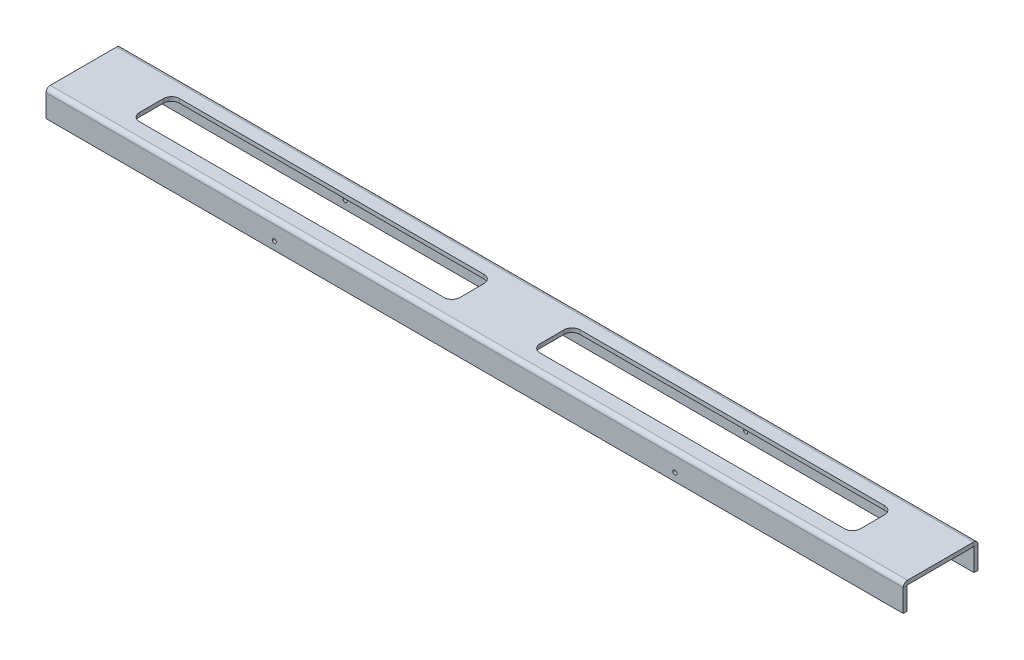
from build123d import *

# Parameters (mm, degrees)
SKETCH_1_W                         = 321
SKETCH_1_H                         = 60
SM_BASE_FLANGE_1_DEPTH             = 1.5
SM_EDGE_FLANGE_1_STRIP_W           = 6.2
SM_EDGE_FLANGE_1_STRIP_H           = 1.5
SM_EDGE_FLANGE_1_STRIP_CUT_DEPTH   = 321
SM_EDGE_FLANGE_1_STRIP_2_W         = 6.2
SM_EDGE_FLANGE_1_STRIP_2_H         = 1.5
SM_EDGE_FLANGE_1_STRIP_CUT_2_DEPTH = 321
SM_EDGE_FLANGE_1_DEPTH             = 321
SM_EDGE_FLANGE_1_BEND_DEPTH        = 321
SM_EDGE_FLANGE_2_STRIP_W           = 6.2
SM_EDGE_FLANGE_2_STRIP_H           = 1.5
SM_EDGE_FLANGE_2_STRIP_CUT_DEPTH   = 321
SM_EDGE_FLANGE_2_STRIP_2_W         = 6.2
SM_EDGE_FLANGE_2_STRIP_2_H         = 1.5
SM_EDGE_FLANGE_2_STRIP_CUT_2_DEPTH = 321
SM_EDGE_FLANGE_2_DEPTH             = 321
SM_EDGE_FLANGE_2_BEND_DEPTH        = 321
CUT_EXTRUDE_2_DEPTH                = 174.385408844
CUT_EXTRUDE_3_DEPTH                = 57
CUT_EXTRUDE_3_DEPTH_BACK           = 10
SKETCH_20_W                        = 341.087454661
SKETCH_20_H                        = 74.910603127
CUT_EXTRUDE_4_DEPTH                = 166.663061664
CUT_EXTRUDE_4_DEPTH_BACK           = 166.663061664
SKETCH_21_R                        = 0.75


# Sheet-metal steps are written as plain solids
with BuildPart() as part:
    # Sketch 1 → 基体-法兰1 (new body)
    with BuildSketch(Plane.XY):
        Rectangle(SKETCH_1_W, SKETCH_1_H)
    extrude(amount=-SM_BASE_FLANGE_1_DEPTH)

    # 边线-法兰1 strip (across the edge) → 边线-法兰1 strip cut (cut)
    with BuildSketch(Plane(origin=(160.5, 30, 0), x_dir=(0, -1, 0), z_dir=(-1, 0, 0))):
        with Locations((-1.5, -0.75)):
            Rectangle(SM_EDGE_FLANGE_1_STRIP_W, SM_EDGE_FLANGE_1_STRIP_H)
    extrude(amount=SM_EDGE_FLANGE_1_STRIP_CUT_DEPTH, mode=Mode.SUBTRACT)

    # 边线-法兰1 strip 2 (across the edge) → 边线-法兰1 strip cut 2 (cut)
    with BuildSketch(Plane(origin=(-160.5, -30, 0), x_dir=(0, 1, 0), z_dir=(1, 0, 0))):
        with Locations((-1.5, -0.75)):
            Rectangle(SM_EDGE_FLANGE_1_STRIP_2_W, SM_EDGE_FLANGE_1_STRIP_2_H)
    extrude(amount=SM_EDGE_FLANGE_1_STRIP_CUT_2_DEPTH, mode=Mode.SUBTRACT)

    # 边线-法兰1 section (across the edge) → 边线-法兰1 (add)
    with BuildSketch(Plane(origin=(160.5, 30, 0), x_dir=(0, -1, 0), z_dir=(-1, 0, 0))):
        with BuildLine():
            Line((0, 0.1), (0, 26.5))
            Line((0, 26.5), (1.5, 26.5))
            Line((1.5, 26.5), (1.5, 0.1))
            ThreePointArc((1.5, 0.1), (1.529289322, 0.029289322), (1.6, 0))
            Line((1.6, 0), (1.6, -1.5))
            ThreePointArc((1.6, -1.5), (0.46862915, -1.03137085), (0, 0.1))
        make_face()
    extrude(amount=SM_EDGE_FLANGE_1_DEPTH)

    # 边线-法兰1 section 2 (across the edge) → 边线-法兰1 bend (add)
    with BuildSketch(Plane(origin=(-160.5, -30, 0), x_dir=(0, 1, 0), z_dir=(1, 0, 0))):
        with BuildLine():
            Line((0, 0.1), (0, 26.5))
            Line((0, 26.5), (1.5, 26.5))
            Line((1.5, 26.5), (1.5, 0.1))
            ThreePointArc((1.5, 0.1), (1.529289322, 0.029289322), (1.6, 0))
            Line((1.6, 0), (1.6, -1.5))
            ThreePointArc((1.6, -1.5), (0.46862915, -1.03137085), (0, 0.1))
        make_face()
    extrude(amount=SM_EDGE_FLANGE_1_BEND_DEPTH)

    # 边线-法兰2 strip (across the edge) → 边线-法兰2 strip cut (cut)
    with BuildSketch(Plane(origin=(160.5, 28.5, 26.5), x_dir=(0, 0, -1), z_dir=(-1, 0, 0))):
        with Locations((-1.5, -0.75)):
            Rectangle(SM_EDGE_FLANGE_2_STRIP_W, SM_EDGE_FLANGE_2_STRIP_H)
    extrude(amount=SM_EDGE_FLANGE_2_STRIP_CUT_DEPTH, mode=Mode.SUBTRACT)

    # 边线-法兰2 strip 2 (across the edge) → 边线-法兰2 strip cut 2 (cut)
    with BuildSketch(Plane(origin=(-160.5, -28.5, 26.5), x_dir=(0, 0, -1), z_dir=(1, 0, 0))):
        with Locations((-1.5, -0.75)):
            Rectangle(SM_EDGE_FLANGE_2_STRIP_2_W, SM_EDGE_FLANGE_2_STRIP_2_H)
    extrude(amount=SM_EDGE_FLANGE_2_STRIP_CUT_2_DEPTH, mode=Mode.SUBTRACT)

    # 边线-法兰2 section (across the edge) → 边线-法兰2 (add)
    with BuildSketch(Plane(origin=(160.5, 28.5, 26.5), x_dir=(0, 0, -1), z_dir=(-1, 0, 0))):
        with BuildLine():
            Line((0, 0.1), (0, 8.5))
            Line((0, 8.5), (1.5, 8.5))
            Line((1.5, 8.5), (1.5, 0.1))
            ThreePointArc((1.5, 0.1), (1.529289322, 0.029289322), (1.6, 0))
            Line((1.6, 0), (1.6, -1.5))
            ThreePointArc((1.6, -1.5), (0.46862915, -1.03137085), (0, 0.1))
        make_face()
    extrude(amount=SM_EDGE_FLANGE_2_DEPTH)

    # 边线-法兰2 section 2 (across the edge) → 边线-法兰2 bend (add)
    with BuildSketch(Plane(origin=(-160.5, -28.5, 26.5), x_dir=(0, 0, -1), z_dir=(1, 0, 0))):
        with BuildLine():
            Line((0, 0.1), (0, 8.5))
            Line((0, 8.5), (1.5, 8.5))
            Line((1.5, 8.5), (1.5, 0.1))
            ThreePointArc((1.5, 0.1), (1.529289322, 0.029289322), (1.6, 0))
            Line((1.6, 0), (1.6, -1.5))
            ThreePointArc((1.6, -1.5), (0.46862915, -1.03137085), (0, 0.1))
        make_face()
    extrude(amount=SM_EDGE_FLANGE_2_BEND_DEPTH)

    # 草图19 → 切除-拉伸2 (cut, through all)
    with BuildSketch(Plane(origin=(0, 30, 0), x_dir=(1, 0, 0), z_dir=(0, 1, 0))):
        with BuildLine():
            Line((-132, -5), (-18, -5))
            ThreePointArc((-18, -5), (-15.878679656, -5.878679656), (-15, -8))
            Line((-15, -8), (-15, -17))
            ThreePointArc((-15, -17), (-15.878679656, -19.121320344), (-18, -20))
            Line((-18, -20), (-132, -20))
            ThreePointArc((-132, -20), (-134.121320344, -19.121320344), (-135, -17))
            Line((-135, -17), (-135, -8))
            ThreePointArc((-135, -8), (-134.121320344, -5.878679656), (-132, -5))
        make_face()
    cut_extrude_2 = extrude(amount=-CUT_EXTRUDE_2_DEPTH, mode=Mode.SUBTRACT)

    # 镜向1: 切除-拉伸2 across plane
    add(cut_extrude_2.mirror(Plane(origin=(0, 0, 0), x_dir=(0, 0, 1), z_dir=(1, 0, 0))), mode=Mode.SUBTRACT)

    # 草图20 → 切除-拉伸3 (cut, two sides: drawn at the far end of the back side and taken through both)
    with BuildSketch(Plane.XY.offset(-CUT_EXTRUDE_3_DEPTH_BACK)):
        with Locations((-10.043727331, -17.455301564)):
            Rectangle(SKETCH_20_W, SKETCH_20_H)
    extrude(amount=CUT_EXTRUDE_3_DEPTH + CUT_EXTRUDE_3_DEPTH_BACK, mode=Mode.SUBTRACT)

    # 草图21 → 切除-拉伸4 (cut, two sides: drawn at the far end of the back side and taken through both)
    with BuildSketch(Plane.XY.offset(26.5).offset(-CUT_EXTRUDE_4_DEPTH_BACK)):
        with Locations(Location((75, 23, 0), (0, 0, 270))):
            Circle(SKETCH_21_R)
        with Locations(Location((-75, 23, 0), (0, 0, 270))):
            Circle(SKETCH_21_R)
    extrude(amount=CUT_EXTRUDE_4_DEPTH + CUT_EXTRUDE_4_DEPTH_BACK, mode=Mode.SUBTRACT)


solid = part.part
